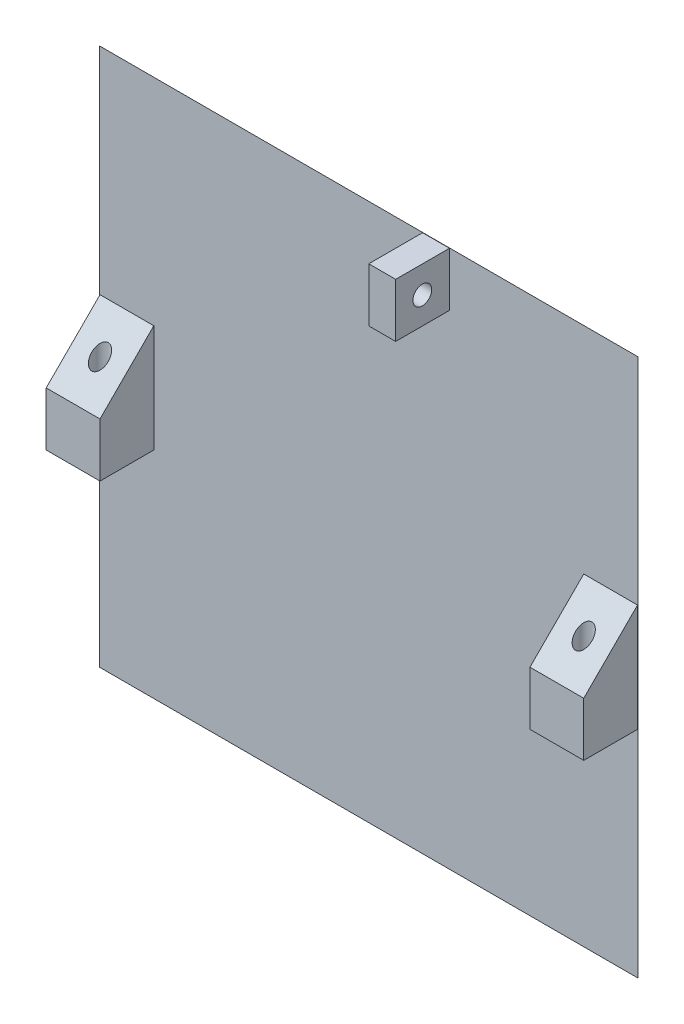
from build123d import *

# Parameters (mm, degrees)
ESQUISSE1_W             = 100
ESQUISSE1_H             = 100
BOSS_EXTRU_1_DEPTH      = 3
ESQUISSE2_W             = 10
ESQUISSE2_H             = 20
BOSS_EXTRU_2_DEPTH      = 10
CHANFREIN1_SIZE         = 10
ESQUISSE3_R             = 1.525
ENL_V_MAT_EXTRU_1_DEPTH = 118.3413823
CHANFREIN2_SIZE         = 3
ESQUISSE4_W             = 5
ESQUISSE4_H             = 10
BOSS_EXTRU_3_DEPTH      = 10
ESQUISSE5_R             = 1.75
ENL_V_MAT_EXTRU_2_DEPTH = 10


with BuildPart() as part:
    # Esquisse1 → Boss.-Extru.1 (new body)
    with BuildSketch(Plane.XY):
        with Locations((50, 50)):
            Rectangle(ESQUISSE1_W, ESQUISSE1_H)
    extrude(amount=BOSS_EXTRU_1_DEPTH)

    # Esquisse2 → Boss.-Extru.2 (add)
    with BuildSketch(Plane.XY.offset(3)):
        with Locations((5.05, 50)):
            Rectangle(ESQUISSE2_W, ESQUISSE2_H)
        with Locations((94.95, 50)):
            Rectangle(ESQUISSE2_W, ESQUISSE2_H)
    extrude(amount=BOSS_EXTRU_2_DEPTH)

    # Chanfrein1
    chanfrein1_edges = [part.edges().sort_by_distance(p)[0] for p in [
        (94.95, 60, 13),
        (5.05, 60, 13),
    ]]
    chamfer(chanfrein1_edges, length=CHANFREIN1_SIZE - 0.0001)  # a hair under: the kernel refuses the full size

    # Esquisse3 → Enlèv. mat.-Extru.1 (cut, through all)
    with BuildSketch(Plane.XZ.offset(-40)):
        with Locations(Location((5.046227865, 8, 0), (0, 0, 270))):
            Circle(ESQUISSE3_R)
        with Locations(Location((94.95, 8, 0), (0, 0, 270))):
            Circle(ESQUISSE3_R)
    extrude(amount=-ENL_V_MAT_EXTRU_1_DEPTH, mode=Mode.SUBTRACT)

    # Chanfrein2
    chanfrein2_edges = [part.edges().sort_by_distance(p)[0] for p in [
        (50, 0, 0),
        (100, 50, 0),
        (50, 100, 0),
        (0, 50, 0),
    ]]
    chamfer(chanfrein2_edges, length=CHANFREIN2_SIZE - 0.0001)  # a hair under: the kernel refuses the full size

    # Esquisse4 → Boss.-Extru.3 (add)
    with BuildSketch(Plane.XY.offset(3)):
        with Locations((62.5, 94.95)):
            Rectangle(ESQUISSE4_W, ESQUISSE4_H)
    extrude(amount=BOSS_EXTRU_3_DEPTH)

    # Esquisse5 → Enlèv. mat.-Extru.2 (cut)
    with BuildSketch(Plane(origin=(65, 0, 0), x_dir=(0, 0, -1), z_dir=(1, 0, 0))):
        with Locations((-8.05, 94.95)):
            Circle(ESQUISSE5_R)
    extrude(amount=-ENL_V_MAT_EXTRU_2_DEPTH, mode=Mode.SUBTRACT)


solid = part.part
